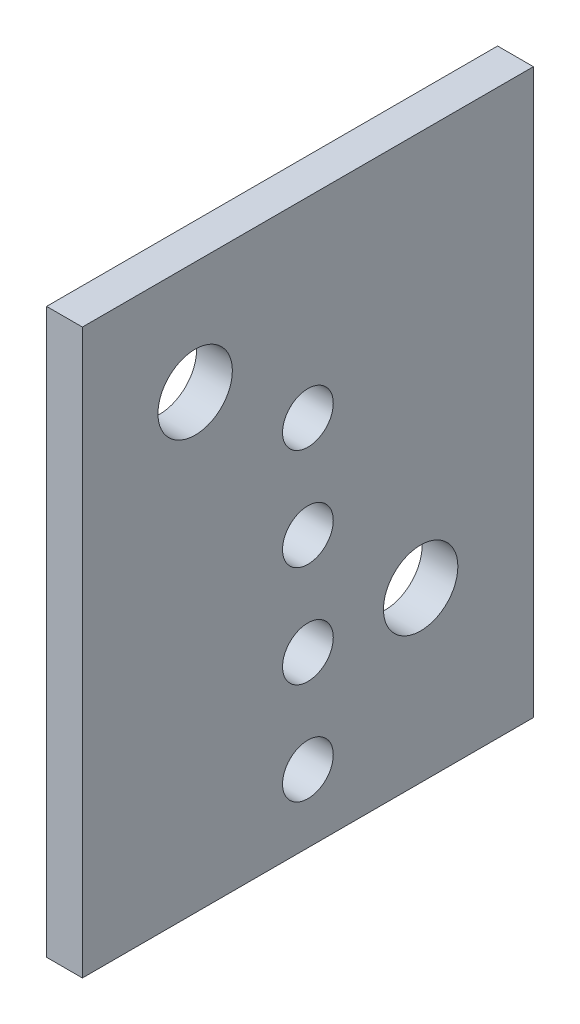
from build123d import *

# Parameters (mm, degrees)
SKETCH1_W           = 40
SKETCH1_H           = 50
SKETCH1_R           = 3.3
SKETCH1_R_2         = 2.25
BOSS_EXTRUDE1_DEPTH = 3.175


with BuildPart() as part:
    # Sketch1 → Boss-Extrude1 (new body)
    with BuildSketch(Plane(origin=(0, 0, 0), x_dir=(0, 0, -1), z_dir=(1, 0, 0))):
        with Locations((20, -25)):
            Rectangle(SKETCH1_W, SKETCH1_H)
        with Locations((30, -35.04)):
            Circle(SKETCH1_R, mode=Mode.SUBTRACT)
        with Locations((10, -10)):
            Circle(SKETCH1_R, mode=Mode.SUBTRACT)
        with Locations((20, -16.974849628)):
            Circle(SKETCH1_R_2, mode=Mode.SUBTRACT)
        with Locations((20, -25.974849628)):
            Circle(SKETCH1_R_2, mode=Mode.SUBTRACT)
        with Locations((20, -34.974849628)):
            Circle(SKETCH1_R_2, mode=Mode.SUBTRACT)
        with Locations((20, -43.974849628)):
            Circle(SKETCH1_R_2, mode=Mode.SUBTRACT)
    extrude(amount=BOSS_EXTRUDE1_DEPTH)


solid = part.part
